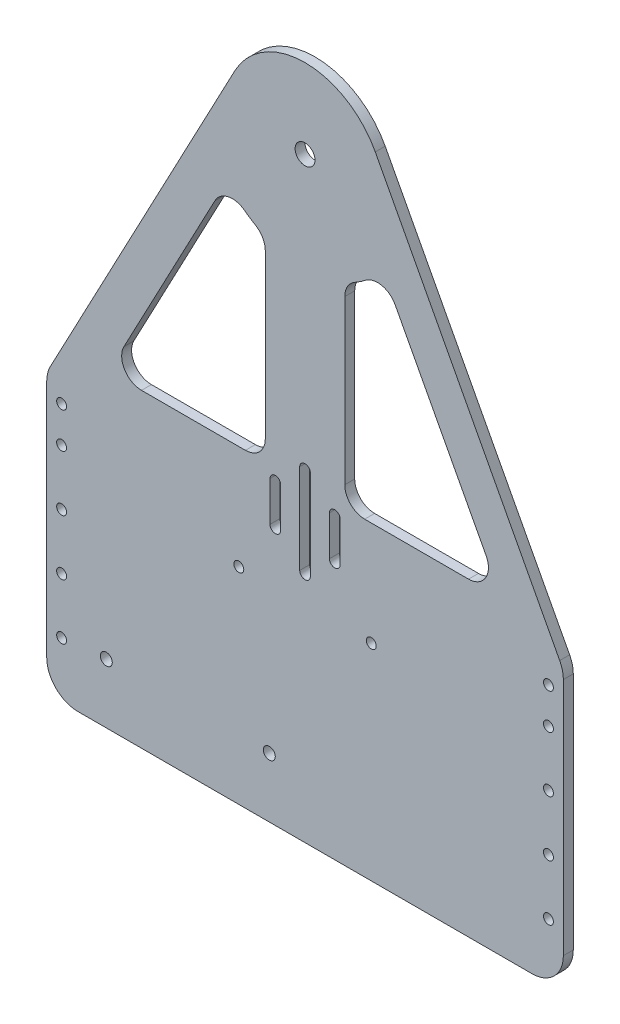
from build123d import *

# Parameters (mm, degrees)
AM_1014_TI_PLATE_BOTTOM_4_AM_0001_ARTEME_START = -3.175
AM_1014_TI_PLATE_BOTTOM_4_AM_0001_AR_2_R       = 1.5875
AM_1014_TI_PLATE_BOTTOM_4_AM_0001_AR_2_R_2     = 1.906243542
AM_1014_TI_PLATE_BOTTOM_4_AM_0001_AR_2_R_3     = 3.175
AM_1014_TI_PLATE_BOTTOM_4_AM_0001_ARTEME_DEPTH = 3.175
BOSS_EXTRUDE1_DEPTH                            = 3.175
FILLET1_R                                      = 10
FILLET2_R                                      = 10


# Read off the part's stored shape, not the designer's step: AM_1014_TI_PLATE_BOTTOM<4>@AM_0001_ARTEMECH
with BuildPart() as part:
    # AM_1014_TI_PLATE_BOTTOM_4_AM_0001_AR 2 → AM_1014_TI_PLATE_BOTTOM<4>@AM_0001_ARTEMECH (new body)
    with BuildSketch(Plane.XY.offset(AM_1014_TI_PLATE_BOTTOM_4_AM_0001_ARTEME_START)):
        with BuildLine():
            Line((-82.55, 70.885609673), (-82.55, -18.014390327))
            Line((-82.55, -18.014390327), (82.55, -18.014390327))
            Line((82.55, -18.014390327), (82.55, 70.885609673))
            Line((82.55, 70.885609673), (22.446426721, 184.373331383))
            ThreePointArc((22.446426721, 184.373331383), (0, 197.885609673), (-22.446426721, 184.373331383))
            Line((-22.446426721, 184.373331383), (-82.55, 70.885609673))
        make_face()
        with Locations((-77.7875, -0.234390327)):
            Circle(AM_1014_TI_PLATE_BOTTOM_4_AM_0001_AR_2_R, mode=Mode.SUBTRACT)
        with Locations((-63.5, 1.035609673)):
            Circle(AM_1014_TI_PLATE_BOTTOM_4_AM_0001_AR_2_R_2, mode=Mode.SUBTRACT)
        with Locations((-77.7875, 17.545609673)):
            Circle(AM_1014_TI_PLATE_BOTTOM_4_AM_0001_AR_2_R, mode=Mode.SUBTRACT)
        with Locations((-77.7875, 35.325609673)):
            Circle(AM_1014_TI_PLATE_BOTTOM_4_AM_0001_AR_2_R, mode=Mode.SUBTRACT)
        with Locations((-11.416585625, 1.035609673)):
            Circle(AM_1014_TI_PLATE_BOTTOM_4_AM_0001_AR_2_R_2, mode=Mode.SUBTRACT)
        with Locations((-77.7875, 53.105609673)):
            Circle(AM_1014_TI_PLATE_BOTTOM_4_AM_0001_AR_2_R, mode=Mode.SUBTRACT)
        with Locations((-77.7875, 64.535609673)):
            Circle(AM_1014_TI_PLATE_BOTTOM_4_AM_0001_AR_2_R, mode=Mode.SUBTRACT)
        with BuildLine():
            Line((-25.4, 42.310609673), (-25.4, 51.835609673))
            ThreePointArc((-25.4, 51.835609673), (-27.25987194, 56.325737733), (-31.75, 58.185609673))
            Line((-31.75, 58.185609673), (-31.651036949, 58.185609673))
            ThreePointArc((-31.651036949, 58.185609673), (-27.160908889, 56.325737733), (-25.301036949, 51.835609673))
            Line((-25.301036949, 51.835609673), (-25.301036949, 42.310609673))
            ThreePointArc((-25.301036949, 42.310609673), (-24.37110098, 40.065545642), (-22.126036949, 39.135609673))
            Line((-22.126036949, 39.135609673), (-22.225, 39.135609673))
            ThreePointArc((-22.225, 39.135609673), (-24.470064031, 40.065545642), (-25.4, 42.310609673))
        make_face(mode=Mode.SUBTRACT)
        with Locations((-21.166666667, 47.762966307)):
            Circle(AM_1014_TI_PLATE_BOTTOM_4_AM_0001_AR_2_R, mode=Mode.SUBTRACT)
        with BuildLine():
            ThreePointArc((-11.2, 77.174125728), (-9.5, 78.874125728), (-7.8, 77.174125728))
            Line((-7.8, 77.174125728), (-7.8, 64.474125728))
            ThreePointArc((-7.8, 64.474125728), (-9.5, 62.774125728), (-11.2, 64.474125728))
            Line((-11.2, 64.474125728), (-11.2, 77.174125728))
        make_face(mode=Mode.SUBTRACT)
        with BuildLine():
            ThreePointArc((-1.7, 85.174125728), (0, 86.874125728), (1.7, 85.174125728))
            Line((1.7, 85.174125728), (1.7, 56.474125728))
            ThreePointArc((1.7, 56.474125728), (0, 54.774125728), (-1.7, 56.474125728))
            Line((-1.7, 56.474125728), (-1.7, 85.174125728))
        make_face(mode=Mode.SUBTRACT)
        with Locations((77.7875, -0.234390327)):
            Circle(AM_1014_TI_PLATE_BOTTOM_4_AM_0001_AR_2_R, mode=Mode.SUBTRACT)
        with Locations((77.7875, 17.545609673)):
            Circle(AM_1014_TI_PLATE_BOTTOM_4_AM_0001_AR_2_R, mode=Mode.SUBTRACT)
        with Locations((77.7875, 35.325609673)):
            Circle(AM_1014_TI_PLATE_BOTTOM_4_AM_0001_AR_2_R, mode=Mode.SUBTRACT)
        with Locations((21.166666667, 47.762966307)):
            Circle(AM_1014_TI_PLATE_BOTTOM_4_AM_0001_AR_2_R, mode=Mode.SUBTRACT)
        with BuildLine():
            ThreePointArc((7.8, 77.174125728), (9.5, 78.874125728), (11.2, 77.174125728))
            Line((11.2, 77.174125728), (11.2, 64.474125728))
            ThreePointArc((11.2, 64.474125728), (9.5, 62.774125728), (7.8, 64.474125728))
            Line((7.8, 64.474125728), (7.8, 77.174125728))
        make_face(mode=Mode.SUBTRACT)
        with Locations((77.7875, 53.105609673)):
            Circle(AM_1014_TI_PLATE_BOTTOM_4_AM_0001_AR_2_R, mode=Mode.SUBTRACT)
        with Locations((77.7875, 64.535609673)):
            Circle(AM_1014_TI_PLATE_BOTTOM_4_AM_0001_AR_2_R, mode=Mode.SUBTRACT)
        with BuildLine():
            ThreePointArc((-28.80539088, 145.230757697), (-24.546211379, 148.463135508), (-19.3281535, 147.296624336))
            ThreePointArc((-19.3281535, 147.296624336), (-17.639343437, 146.086441824), (-15.875, 144.989303103))
            ThreePointArc((-15.875, 144.989303103), (-13.550738686, 142.665041789), (-12.7, 139.490041789))
            Line((-12.7, 139.490041789), (-12.7, 87.395609673))
            ThreePointArc((-12.7, 87.395609673), (-14.559871939, 82.905481612), (-19.05, 81.045609673))
            Line((-19.05, 81.045609673), (-52.249574284, 81.045609673))
            ThreePointArc((-52.249574284, 81.045609673), (-57.689898641, 84.120648468), (-57.861180964, 90.3675401))
            Line((-57.861180964, 90.3675401), (-28.80539088, 145.230757697))
        make_face(mode=Mode.SUBTRACT)
        with Locations((0, 172.485609673)):
            Circle(AM_1014_TI_PLATE_BOTTOM_4_AM_0001_AR_2_R_3, mode=Mode.SUBTRACT)
        with BuildLine():
            ThreePointArc((12.7, 139.490041789), (13.550738686, 142.665041789), (15.875, 144.989303103))
            ThreePointArc((15.875, 144.989303103), (17.639343437, 146.086441824), (19.3281535, 147.296624336))
            ThreePointArc((19.3281535, 147.296624336), (24.546211379, 148.463135508), (28.80539088, 145.230757697))
            Line((28.80539088, 145.230757697), (57.861180964, 90.3675401))
            ThreePointArc((57.861180964, 90.3675401), (57.689898641, 84.120648468), (52.249574284, 81.045609673))
            Line((52.249574284, 81.045609673), (19.05, 81.045609673))
            ThreePointArc((19.05, 81.045609673), (14.559871939, 82.905481612), (12.7, 87.395609673))
            Line((12.7, 87.395609673), (12.7, 139.490041789))
        make_face(mode=Mode.SUBTRACT)
    extrude(amount=AM_1014_TI_PLATE_BOTTOM_4_AM_0001_ARTEME_DEPTH)

    # Sketch2 → Boss-Extrude1 (add)
    with BuildSketch(Plane.XY):
        Polygon((-34.947413532, 60.439294241), (-28.081020706, 36.459737757), (-19.207528438, 36.459737757), (-20.497701901, 40.965420465), (-23.644274572, 43.537404208), (-23.644274572, 54.206722292), (-24.602914342, 57.554587336), (-28.081020706, 60.39756411), align=None)
    extrude(amount=-BOSS_EXTRUDE1_DEPTH)

    # Fillet1
    fillet1_edges = [part.edges().sort_by_distance(p)[0] for p in [
        (-82.55, -18.014390327, -1.5875),
        (82.55, -18.014390327, -1.5875),
    ]]
    fillet(fillet1_edges, radius=FILLET1_R)

    # Fillet2
    fillet2_edges = [part.edges().sort_by_distance(p)[0] for p in [
        (82.55, 70.885609673, -1.5875),
        (-82.55, 70.885609673, -1.5875),
    ]]
    fillet(fillet2_edges, radius=FILLET2_R)


solid = part.part
